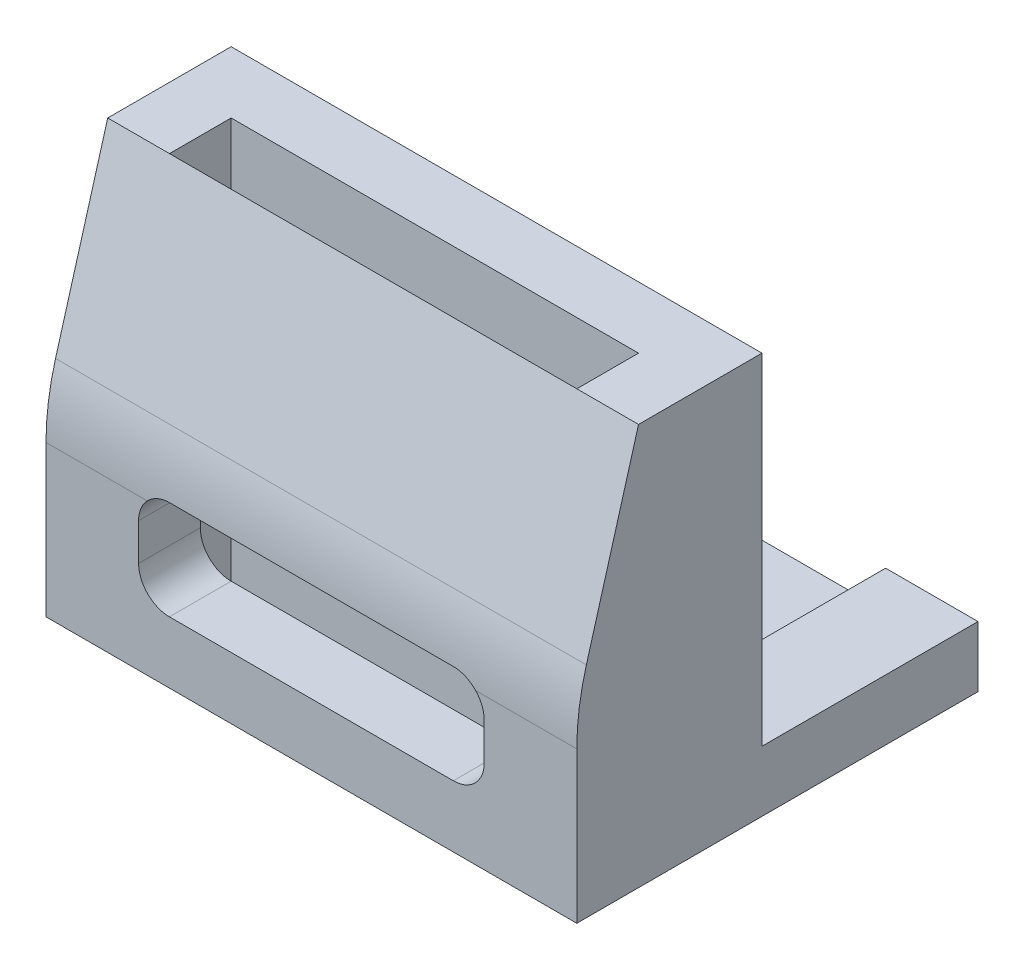
from build123d import *

# Parameters (mm, degrees)
SKETCH1_W           = 17.2
SKETCH1_H           = 6
SKETCH1_W_2         = 13.2
SKETCH1_H_2         = 2
BOSS_EXTRUDE1_DEPTH = 13
CUT_EXTRUDE1_DEPTH  = 13
SKETCH4_W           = 17.2
SKETCH4_H           = 1.968955047
BOSS_EXTRUDE2_DEPTH = 7
SKETCH5_R           = 1.6
CUT_EXTRUDE2_DEPTH  = 4
CUT_EXTRUDE3_START  = -7
SKETCH6_W           = 11.206506984
SKETCH6_H           = 2.48590404
CUT_EXTRUDE3_DEPTH  = 7
CUT_EXTRUDE4_START  = -17.2
CUT_EXTRUDE4_DEPTH  = 17.2
FILLET1_R           = 8


with BuildPart() as part:
    # Sketch1 → Boss-Extrude1 (new body)
    with BuildSketch(Plane(origin=(0, 0, 0), x_dir=(1, 0, 0), z_dir=(0, 1, 0))):
        with Locations((6.6, 1)):
            Rectangle(SKETCH1_W, SKETCH1_H)
        with Locations((6.6, 1)):
            Rectangle(SKETCH1_W_2, SKETCH1_H_2, mode=Mode.SUBTRACT)
    extrude(amount=BOSS_EXTRUDE1_DEPTH)

    # Sketch2 → Cut-Extrude1 (cut)
    with BuildSketch(Plane.XY.offset(2)):
        with BuildLine():
            Line((2, 5.2), (11.2, 5.2))
            ThreePointArc((11.2, 5.2), (11.907106781, 4.907106781), (12.2, 4.2))
            Line((12.2, 4.2), (12.2, 3))
            ThreePointArc((12.2, 3), (11.907106781, 2.292893219), (11.2, 2))
            Line((11.2, 2), (2, 2))
            ThreePointArc((2, 2), (1.292893219, 2.292893219), (1, 3))
            Line((1, 3), (1, 4.2))
            ThreePointArc((1, 4.2), (1.292893219, 4.907106781), (2, 5.2))
        make_face()
    extrude(amount=-CUT_EXTRUDE1_DEPTH, mode=Mode.SUBTRACT)

    # Sketch4 → Boss-Extrude2 (add)
    with BuildSketch(Plane(origin=(0, 0, -4), x_dir=(-1, 0, 0), z_dir=(0, 0, -1))):
        with Locations((-6.6, 0.984477524)):
            Rectangle(SKETCH4_W, SKETCH4_H)
    extrude(amount=BOSS_EXTRUDE2_DEPTH)

    # Sketch5 → Cut-Extrude2 (cut)
    with BuildSketch(Plane(origin=(0, 1.968955047, 0), x_dir=(1, 0, 0), z_dir=(0, 1, 0))):
        with Locations(Location((6.6, 7.5, 0), (0, 0, 270))):
            Circle(SKETCH5_R)
    extrude(amount=-CUT_EXTRUDE2_DEPTH, mode=Mode.SUBTRACT)

    # Sketch6 → Cut-Extrude3 (cut)
    with BuildSketch(Plane(origin=(0, 0, -11), x_dir=(-1, 0, 0), z_dir=(0, 0, -1)).offset(CUT_EXTRUDE3_START)):
        with Locations((-6.603253492, 1.995400835)):
            Rectangle(SKETCH6_W, SKETCH6_H)
    extrude(amount=CUT_EXTRUDE3_DEPTH, mode=Mode.SUBTRACT)

    # Sketch7 → Cut-Extrude4 (cut)
    with BuildSketch(Plane(origin=(15.2, 0, 0), x_dir=(0, 0, -1), z_dir=(1, 0, 0)).offset(CUT_EXTRUDE4_START)):
        Polygon((0, 13), (-2, 6.017150325), (-2, 13), align=None)
    extrude(amount=CUT_EXTRUDE4_DEPTH, mode=Mode.SUBTRACT)

    # Fillet1
    # the kernel refuses this fillet: 8 mm, written as the material it takes off along each edge
    with BuildSketch(Plane(origin=(-4.807712941, 6.017150325, 2), x_dir=(0, -1, 0), z_dir=(1, 0, 0))) as fillet1_piece_1:
        with BuildLine():
            CenterArc((FILLET1_R * 0.140385647075, FILLET1_R), FILLET1_R, 254.01743912, 15.98256088)
            Line((-FILLET1_R * 0.134959116702, FILLET1_R * 0.0386544528314), (0, 0))
            Line((0, 0), (FILLET1_R * 0.140385647075, 0))
        make_face()
    extrude(amount=22.815425883, mode=Mode.SUBTRACT)


solid = part.part
